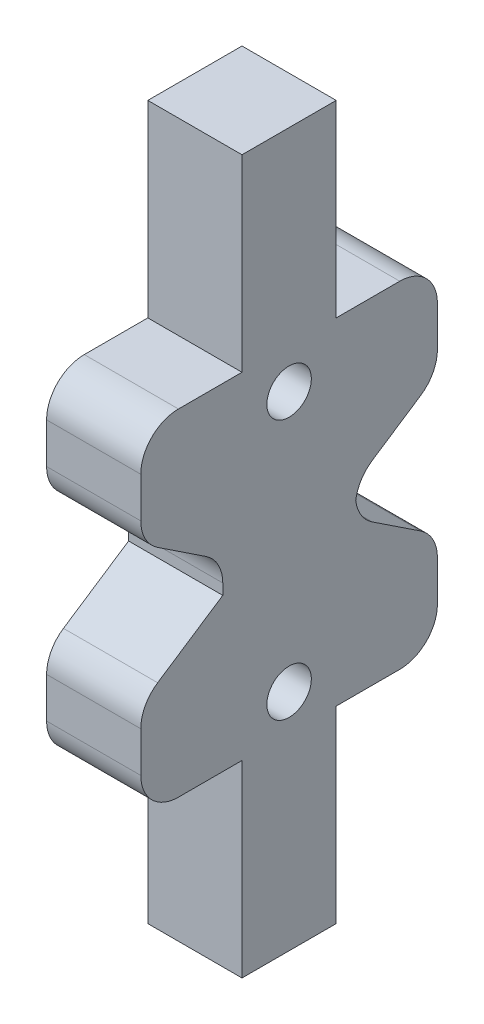
from build123d import *

# Parameters (mm, degrees)
SKETCH1_R           = 1.49987
BOSS_EXTRUDE1_DEPTH = 6.35
FILLET1_R           = 2.54


with BuildPart() as part:
    # Sketch1 → Boss-Extrude1 (new body)
    with BuildSketch(Plane(origin=(0, 0, 0), x_dir=(0, 0, -1), z_dir=(1, 0, 0))):
        Polygon((0, 0), (6.825, 0), (6.825, -12.7), (13.175, -12.7), (13.175, 0), (20, 0), (20, 6.629574014), (14.471500996, 10.288392178), (14.471500996, 12.377602622), (20, 16.036420786), (20, 22.6659948), (13.175, 22.6659948), (13.175, 35.3659948), (6.825, 35.3659948), (6.825, 22.6659948), (0, 22.6659948), (0, 16.036420786), (5.528499004, 12.377602622), (5.528499004, 10.288392178), (0, 6.629574014), align=None)
        with Locations((10, 19.9520048)):
            Circle(SKETCH1_R, mode=Mode.SUBTRACT)
        with Locations((10, 2.4260048)):
            Circle(SKETCH1_R, mode=Mode.SUBTRACT)
    extrude(amount=BOSS_EXTRUDE1_DEPTH)

    # Fillet1
    # the kernel refuses this fillet: 2.54 mm, written as the material it adds along each edge
    with BuildSketch(Plane(origin=(0, 12.377602622, -14.471500996), x_dir=(0, -1, 0), z_dir=(1, 0, 0)), Plane(origin=(0, 10.288392178, -14.471500996), x_dir=(0, -0.5518934032294348, -0.8339146667806201), z_dir=(1, 0, 0)), Plane(origin=(0, 12.377602622, -5.528499004), x_dir=(0, 0.5518934032294354, 0.8339146667806197), z_dir=(1, 0, 0))) as fillet1_piece_1:
        with BuildLine():
            CenterArc((FILLET1_R * 0.537353058558, FILLET1_R), FILLET1_R, 213.497005554, 56.502994446)
            Line((-FILLET1_R * 0.296561608223, FILLET1_R * 0.448106596771), (0, 0))
            Line((0, 0), (FILLET1_R * 0.537353058558, 0))
        make_face()
    extrude(amount=6.35)
    # the kernel refuses this fillet: 2.54 mm, written as the material it takes off along each edge
    with BuildSketch(Plane(origin=(-3.412191922, 16.036420786, -20), x_dir=(0, -0.5518934032294348, 0.8339146667806201), z_dir=(1, 0, 0)), Plane(origin=(-3.412191922, 6.629574014, -20), x_dir=(0, -1, 0), z_dir=(1, 0, 0)), Plane(origin=(-3.412191922, 16.036420786, 0), x_dir=(0, 1, 0), z_dir=(1, 0, 0))) as fillet1_2_piece_1:
        with BuildLine():
            CenterArc((FILLET1_R * 0.537353058558, -FILLET1_R), FILLET1_R, 90, 56.502994446)
            Line((-FILLET1_R * 0.296561608223, -FILLET1_R * 0.448106596771), (0, 0))
            Line((0, 0), (FILLET1_R * 0.537353058558, 0))
        make_face()
    extrude(amount=13.174383844, mode=Mode.SUBTRACT)
    with BuildSketch(Plane(origin=(-6.35, 0, -20), x_dir=(0, 0, 1), z_dir=(1, 0, 0)), Plane(origin=(-6.35, 22.6659948, 0), x_dir=(0, 0, -1), z_dir=(1, 0, 0)), Plane(origin=(-6.35, 22.6659948, -20), x_dir=(0, -1, 0), z_dir=(1, 0, 0))) as fillet1_2_piece_2:
        with BuildLine():
            CenterArc((FILLET1_R, -FILLET1_R), FILLET1_R, 90, 90)
            Line((0, -FILLET1_R), (0, 0))
            Line((0, 0), (FILLET1_R, 0))
        make_face()
    extrude(amount=19.05, mode=Mode.SUBTRACT)
    with BuildSketch(Plane(origin=(-6.35, 0, 0), x_dir=(0, 0, -1), z_dir=(1, 0, 0))) as fillet1_2_piece_3:
        with BuildLine():
            CenterArc((FILLET1_R, FILLET1_R), FILLET1_R, 180, 90)
            Line((0, FILLET1_R), (0, 0))
            Line((0, 0), (FILLET1_R, 0))
        make_face()
    extrude(amount=19.05, mode=Mode.SUBTRACT)
    with BuildSketch(Plane(origin=(-3.412191922, 6.629574014, 0), x_dir=(0, -1, 0), z_dir=(1, 0, 0))) as fillet1_2_piece_4:
        with BuildLine():
            CenterArc((FILLET1_R * 0.537353058558, FILLET1_R), FILLET1_R, 213.497005554, 56.502994446)
            Line((-FILLET1_R * 0.296561608223, FILLET1_R * 0.448106596771), (0, 0))
            Line((0, 0), (FILLET1_R * 0.537353058558, 0))
        make_face()
    extrude(amount=13.174383844, mode=Mode.SUBTRACT)


solid = part.part
